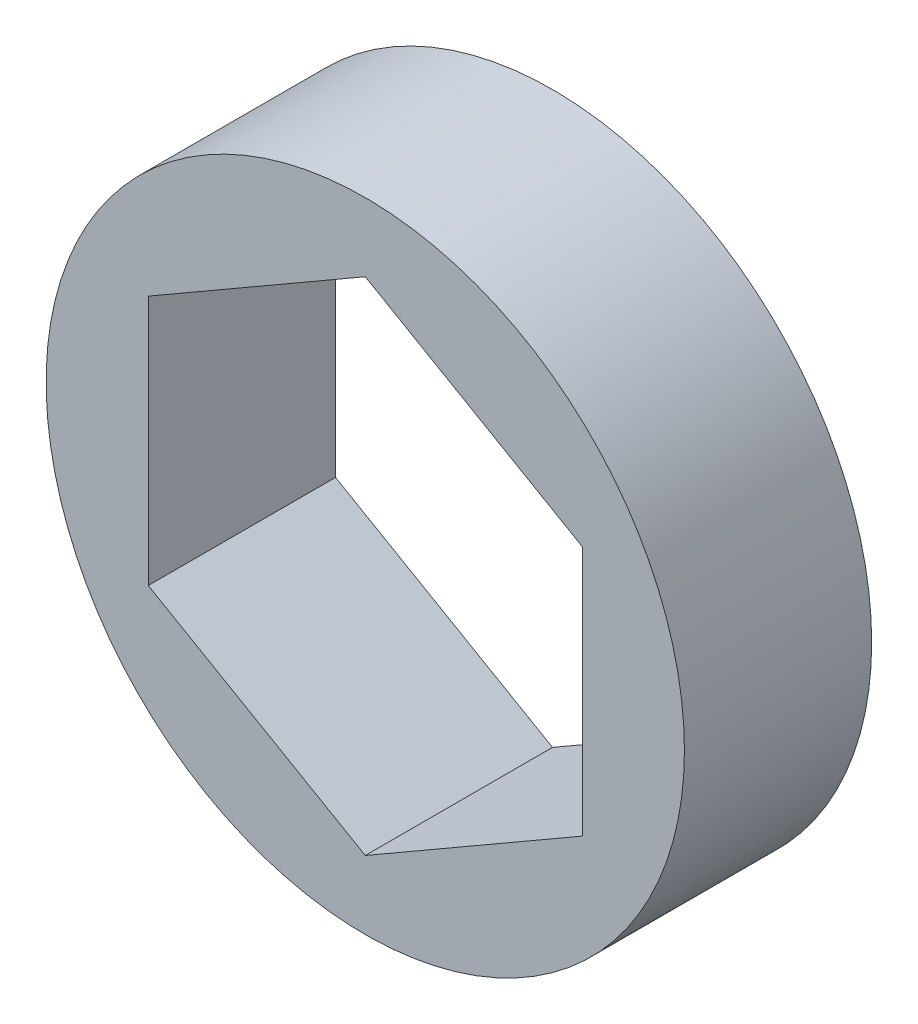
from build123d import *

# Parameters (mm, degrees)
SKETCH1_R           = 9.525
BOSS_EXTRUDE1_DEPTH = 5.588


with BuildPart() as part:
    # Sketch1 → Boss-Extrude1 (new body)
    with BuildSketch(Plane.XY):
        Circle(SKETCH1_R)
        Polygon((0, 7.478995387), (-6.477, 3.739497694), (-6.477, -3.739497694), (0, -7.478995387), (6.477, -3.739497694), (6.477, 3.739497694), align=None, mode=Mode.SUBTRACT)
    extrude(amount=BOSS_EXTRUDE1_DEPTH)


solid = part.part
